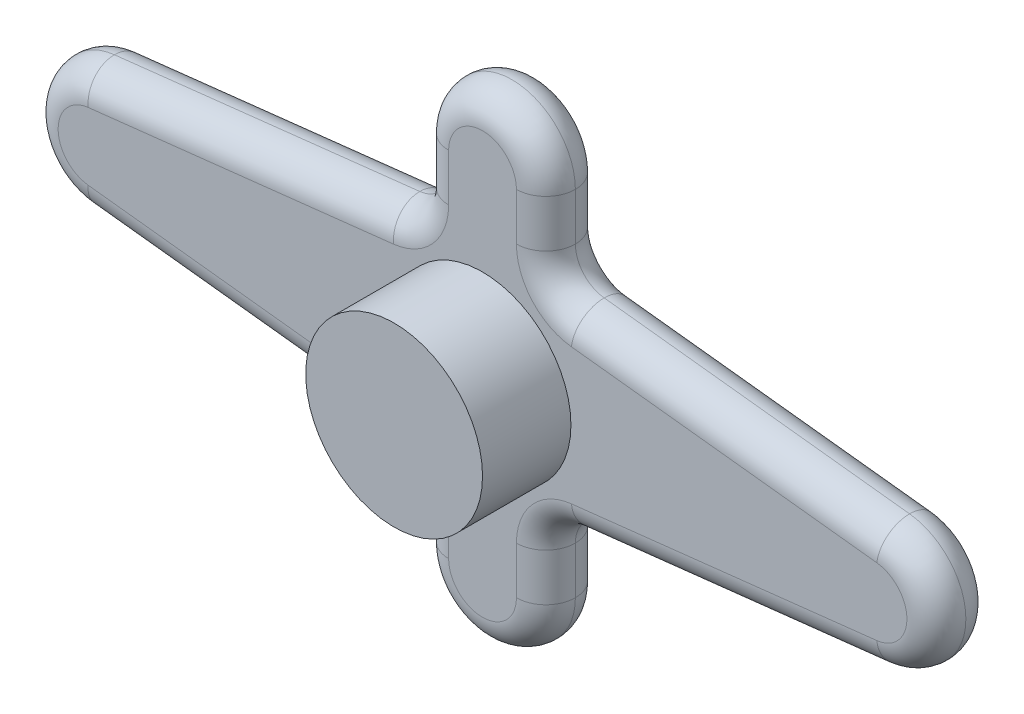
from build123d import *

# Parameters (mm, degrees)
BOSS_EXTRUDE1_DEPTH = 2
SKETCH2_R           = 3
BOSS_EXTRUDE2_DEPTH = 3
FILLET1_R           = 1


with BuildPart() as part:
    # Sketch1 → Boss-Extrude1 (new body)
    with BuildSketch(Plane.XY.offset(1307.677843453)):
        with BuildLine():
            Line((676.233867879, 870.804107087), (676.233867879, 869.198049015))
            ThreePointArc((676.233867879, 869.198049015), (678.383867879, 867.048049015), (680.533867879, 869.198049015))
            Line((680.533867879, 869.198049015), (680.533867879, 870.804107087))
            ThreePointArc((680.533867879, 870.804107087), (680.81377857, 871.537219306), (681.511056106, 871.897229801))
            Line((681.511056106, 871.897229801), (691.873909071, 873.061490983))
            ThreePointArc((691.873909071, 873.061490983), (693.783867879, 875.198049016), (691.873909071, 877.334607048))
            Line((691.873909071, 877.334607048), (681.511056106, 878.49886823))
            ThreePointArc((681.511056106, 878.49886823), (680.81377857, 878.858878725), (680.533867879, 879.591990944))
            Line((680.533867879, 879.591990944), (680.533867879, 881.198049015))
            ThreePointArc((680.533867879, 881.198049015), (678.383867879, 883.348049015), (676.233867879, 881.198049015))
            Line((676.233867879, 881.198049015), (676.233867879, 879.591990944))
            ThreePointArc((676.233867879, 879.591990944), (675.953957188, 878.858878725), (675.256679652, 878.49886823))
            Line((675.256679652, 878.49886823), (664.893826687, 877.334607048))
            ThreePointArc((664.893826687, 877.334607048), (662.983867879, 875.198049015), (664.893826687, 873.061490983))
            Line((664.893826687, 873.061490983), (675.256679652, 871.897229801))
            ThreePointArc((675.256679652, 871.897229801), (675.953957188, 871.537219305), (676.233867879, 870.804107087))
        make_face()
    extrude(amount=BOSS_EXTRUDE1_DEPTH)

    # Sketch2 → Boss-Extrude2 (add)
    with BuildSketch(Plane.XY.offset(1309.677843453)):
        with Locations((678.383867879, 875.198049015)):
            Circle(SKETCH2_R)
    extrude(amount=BOSS_EXTRUDE2_DEPTH)

    # Fillet1
    fillet1_edges = [part.edges().sort_by_distance(p)[0] for p in [
        (675.953957188, 878.858878725, 1307.677843453),
        (676.233867879, 880.39501998, 1307.677843453),
        (678.383867879, 883.348049015, 1307.677843453),
        (680.533867879, 880.39501998, 1307.677843453),
        (680.81377857, 878.858878725, 1307.677843453),
        (686.692482589, 877.916737639, 1307.677843453),
        (693.783867879, 875.198049016, 1307.677843453),
        (686.692482589, 872.479360392, 1307.677843453),
        (680.81377857, 871.537219306, 1307.677843453),
        (680.533867879, 870.001078051, 1307.677843453),
        (678.383867879, 867.048049015, 1307.677843453),
        (676.233867879, 870.001078051, 1307.677843453),
        (675.953957188, 871.537219305, 1307.677843453),
        (670.075253169, 872.479360392, 1307.677843453),
        (662.983867879, 875.198049015, 1307.677843453),
        (670.075253169, 877.916737639, 1307.677843453),
        (675.953957188, 878.858878725, 1309.677843453),
        (676.233867879, 880.39501998, 1309.677843453),
        (678.383867879, 883.348049015, 1309.677843453),
        (680.533867879, 880.39501998, 1309.677843453),
        (680.81377857, 878.858878725, 1309.677843453),
        (686.692482589, 877.916737639, 1309.677843453),
        (693.783867879, 875.198049016, 1309.677843453),
        (686.692482589, 872.479360392, 1309.677843453),
        (680.81377857, 871.537219306, 1309.677843453),
        (680.533867879, 870.001078051, 1309.677843453),
        (678.383867879, 867.048049015, 1309.677843453),
        (676.233867879, 870.001078051, 1309.677843453),
        (675.953957188, 871.537219305, 1309.677843453),
        (670.075253169, 872.479360392, 1309.677843453),
        (662.983867879, 875.198049015, 1309.677843453),
        (670.075253169, 877.916737639, 1309.677843453),
    ]]
    fillet(fillet1_edges, radius=FILLET1_R - 0.0001)  # a hair under: the kernel refuses the full size


solid = part.part
